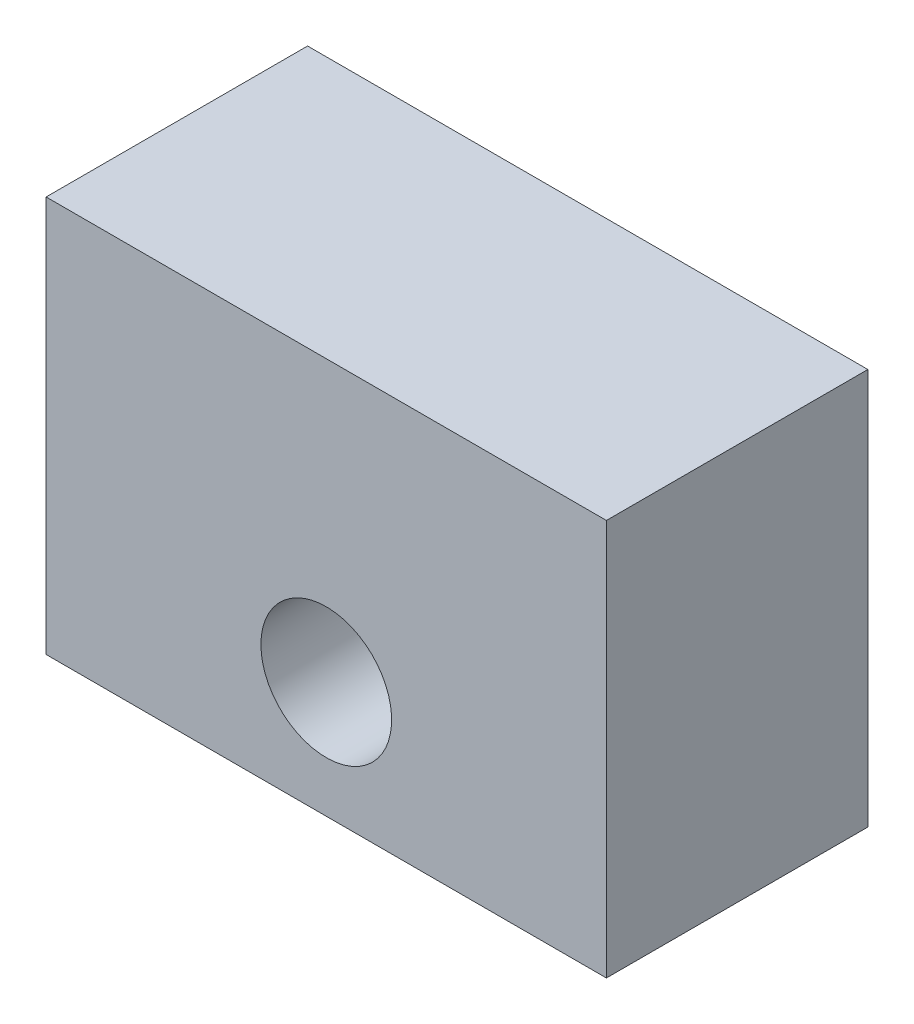
from build123d import *

# Parameters (mm, degrees)
SKETCH1_W                = 15
SKETCH1_H                = 60
BOSS_EXTRUDE2_DEPTH      = 39.11
BOSS_EXTRUDE3_DEPTH      = 12
BOSS_EXTRUDE3_DEPTH_BACK = 27
SKETCH3_W                = 60
SKETCH3_H                = 5
RIB1_REACH               = 55.008
SKETCH5_WALL_W           = 127.334599132
SKETCH5_WALL_H           = 10
SKETCH6_R                = 1.5
CUT_EXTRUDE2_DEPTH       = 50.434219929
SKETCH7_W                = 16
SKETCH7_H                = 16
CUT_EXTRUDE3_DEPTH       = 57.201353187
SKETCH8_R                = 1.75
CUT_EXTRUDE4_DEPTH       = 75.228310637
FILLET1_R                = 3
CUT_EXTRUDE5_DEPTH       = 75.228310637
SKETCH11_W               = 15
SKETCH11_H               = 10.608893068
CUT_EXTRUDE6_DEPTH       = 67.293605272


with BuildPart() as part:
    # Sketch1 → Boss-Extrude2 (new body)
    with BuildSketch(Plane(origin=(0, 0, 0), x_dir=(1, 0, 0), z_dir=(0, 1, 0))):
        Rectangle(SKETCH1_W, SKETCH1_H)
    extrude(amount=BOSS_EXTRUDE2_DEPTH)

    # Sketch3 → Boss-Extrude3 (add, two sides: drawn at the far end of the back side and taken through both)
    with BuildSketch(Plane.ZY.offset(7.5).offset(-BOSS_EXTRUDE3_DEPTH_BACK)):
        with Locations((0, 2.5)):
            Rectangle(SKETCH3_W, SKETCH3_H)
    extrude(amount=BOSS_EXTRUDE3_DEPTH + BOSS_EXTRUDE3_DEPTH_BACK)

    # Sketch5 wall → Rib1 (add, up to next)
    with BuildSketch(Plane(origin=(-12.037058369, 13.5275, 0), x_dir=(-0.46970610176, -0.882822846311, 0), z_dir=(0.882822846311, -0.46970610176, 0)), mode=Mode.PRIVATE) as rib1_sk1:
        Rectangle(SKETCH5_WALL_W, SKETCH5_WALL_H)
    rib1_tool1 = extrude(rib1_sk1.sketch, amount=RIB1_REACH, mode=Mode.PRIVATE) - part.part
    rib1 = rib1_tool1.solids().sort_by_distance((-12.037058369, 13.5275, 0))[0]
    add(rib1)

    # Sketch6 → Cut-Extrude2 (cut, through all)
    with BuildSketch(Plane(origin=(0, 5, 0), x_dir=(1, 0, 0), z_dir=(0, 1, 0))):
        with Locations((-14.5, -25)):
            Circle(SKETCH6_R)
        with Locations((-14.5, 25)):
            Circle(SKETCH6_R)
    cut_extrude2 = extrude(amount=-CUT_EXTRUDE2_DEPTH, mode=Mode.SUBTRACT)

    # Mirror1: Rib1, Cut-Extrude2 across plane
    add(rib1.mirror(Plane(origin=(0, 0, 0), x_dir=(0, 0, 1), z_dir=(1, 0, 0))))
    add(cut_extrude2.mirror(Plane(origin=(0, 0, 0), x_dir=(0, 0, 1), z_dir=(1, 0, 0))), mode=Mode.SUBTRACT)

    # Sketch7 → Cut-Extrude3 (cut, through all)
    with BuildSketch(Plane.ZY.offset(7.5)):
        with Locations((15, 31.11)):
            Rectangle(SKETCH7_W, SKETCH7_H)
    cut_extrude3 = extrude(amount=-CUT_EXTRUDE3_DEPTH, mode=Mode.SUBTRACT)

    # Mirror2: Cut-Extrude3 across plane
    add(cut_extrude3.mirror(Plane.XY), mode=Mode.SUBTRACT)

    # Sketch8 → Cut-Extrude4 (cut, through all)
    with BuildSketch(Plane(origin=(0, 0, -30), x_dir=(-1, 0, 0), z_dir=(0, 0, -1))):
        with Locations((0, 31.61)):
            Circle(SKETCH8_R)
    extrude(amount=-CUT_EXTRUDE4_DEPTH, mode=Mode.SUBTRACT)

    # Fillet1
    fillet1_edges = [part.edges().sort_by_distance(p)[0] for p in [
        (-16.574116738, 5, 0),
        (-7.5, 5, -17.5),
        (-7.5, 5, 17.5),
        (16.574116738, 5, 0),
        (7.5, 5, 17.5),
        (7.5, 5, -17.5),
    ]]
    fillet(fillet1_edges, radius=FILLET1_R)
    fillet1_2_edges = [part.edges().sort_by_distance(p)[0] for p in [
        (19.5, 2.5, -30),
        (19.5, 2.5, 30),
        (-19.5, 2.5, 30),
        (-19.5, 2.5, -30),
    ]]
    fillet(fillet1_2_edges, radius=FILLET1_R)

    # Sketch10 → Cut-Extrude5 (cut, through all)
    with BuildSketch(Plane.XY.offset(30)):
        Polygon((7.5, 28.501106932), (-7.5, 28.501106932), (-22.220470771, 28.501106932), (-22.220470771, 0), (19.5, 0), (19.5, 28.501106932), align=None)
    extrude(amount=-CUT_EXTRUDE5_DEPTH, mode=Mode.SUBTRACT)


with BuildPart() as cut_extrude5_piece_1:
    # of the separate pieces the step leaves, piece 1, a body of its own (cut_extrude5_pieces)
    add(part.part.solids().sort_by_distance((7.5, 39.11, 7))[0])


with BuildPart() as cut_extrude5_piece_2:
    # of the separate pieces the step leaves, piece 2, a body of its own (cut_extrude5_pieces)
    add(part.part.solids().sort_by_distance((7.5, 28.501106932, 30))[0])


with BuildPart() as cut_extrude5_piece_3:
    # of the separate pieces the step leaves, piece 3, a body of its own (cut_extrude5_pieces)
    add(part.part.solids().sort_by_distance((-7.5, 28.501106932, -30))[0])


with BuildPart() as cut_extrude6_tool:
    # Sketch11 → Cut-Extrude6 (new, through all)
    with BuildSketch(Plane(origin=(0, 0, 23), x_dir=(-1, 0, 0), z_dir=(0, 0, -1))):
        with Locations((0, 33.805553466)):
            Rectangle(SKETCH11_W, SKETCH11_H)
    extrude(amount=CUT_EXTRUDE6_DEPTH)


with BuildPart() as cut_extrude5_piece_1_1:
    add(cut_extrude5_piece_1.part)

    # Cut-Extrude6: cut by cut_extrude6_tool
    add(cut_extrude6_tool.part, mode=Mode.SUBTRACT)


with BuildPart() as cut_extrude5_piece_3_1:
    add(cut_extrude5_piece_3.part)

    # Cut-Extrude6: cut by cut_extrude6_tool
    add(cut_extrude6_tool.part, mode=Mode.SUBTRACT)


solid = cut_extrude5_piece_2.part
